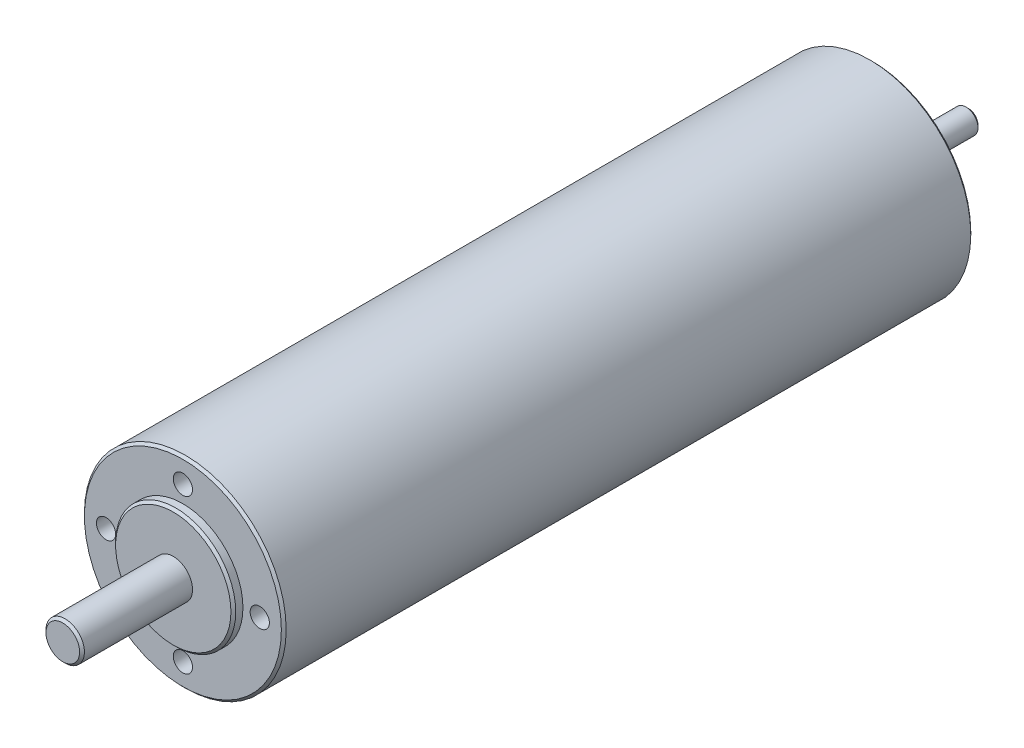
from build123d import *

# Parameters (mm, degrees)
ESQUISSE1_R          = 21
BASE_EXTRUSION_DEPTH = 143.5
ESQUISSE2_R          = 12.5
BOSS_EXTRU_1_DEPTH   = 2
ESQUISSE3_R          = 4
BOSS_EXTRU_2_DEPTH   = 23
ESQUISSE4_R          = 11
BOSS_EXTRU_3_DEPTH   = 2
ESQUISSE5_R          = 2.5
BOSS_EXTRU_4_DEPTH   = 18
CHANFREIN1_SIZE      = 0.5
SKETCH1_R            = 2
EXTRUDE1_DEPTH       = 10


with BuildPart() as part:
    # Esquisse1 → Base-Extrusion (new body)
    with BuildSketch(Plane.XY):
        Circle(ESQUISSE1_R)
    extrude(amount=-BASE_EXTRUSION_DEPTH)

    # Esquisse2 → Boss.-Extru.1 (add)
    with BuildSketch(Plane.XY):
        Circle(ESQUISSE2_R)
    extrude(amount=BOSS_EXTRU_1_DEPTH)

    # Esquisse3 → Boss.-Extru.2 (add)
    with BuildSketch(Plane.XY.offset(2)):
        Circle(ESQUISSE3_R)
    extrude(amount=BOSS_EXTRU_2_DEPTH)

    # Esquisse4 → Boss.-Extru.3 (add)
    with BuildSketch(Plane(origin=(0, 0, -143.5), x_dir=(-1, 0, 0), z_dir=(0, 0, -1))):
        Circle(ESQUISSE4_R)
    extrude(amount=BOSS_EXTRU_3_DEPTH)

    # Esquisse5 → Boss.-Extru.4 (add)
    with BuildSketch(Plane(origin=(0, 0, -145.5), x_dir=(-1, 0, 0), z_dir=(0, 0, -1))):
        Circle(ESQUISSE5_R)
    extrude(amount=BOSS_EXTRU_4_DEPTH)

    # Chanfrein1
    chanfrein1_edges = [part.edges().sort_by_distance(p)[0] for p in [
        (-4, 0, 25),
        (-12.5, 0, 2),
        (-21, 0, 0),
        (-21, 0, -143.5),
        (11, 0, -145.5),
        (2.5, 0, -163.5),
    ]]
    chamfer(chanfrein1_edges, length=CHANFREIN1_SIZE)

    # Sketch1 → Extrude1 (cut)
    with BuildSketch(Plane.XY):
        with Locations((0, 16)):
            Circle(SKETCH1_R)
        with Locations((16, 0)):
            Circle(SKETCH1_R)
        with Locations((0, -16)):
            Circle(SKETCH1_R)
        with Locations((-16, 0)):
            Circle(SKETCH1_R)
    extrude(amount=-EXTRUDE1_DEPTH, mode=Mode.SUBTRACT)


solid = part.part
